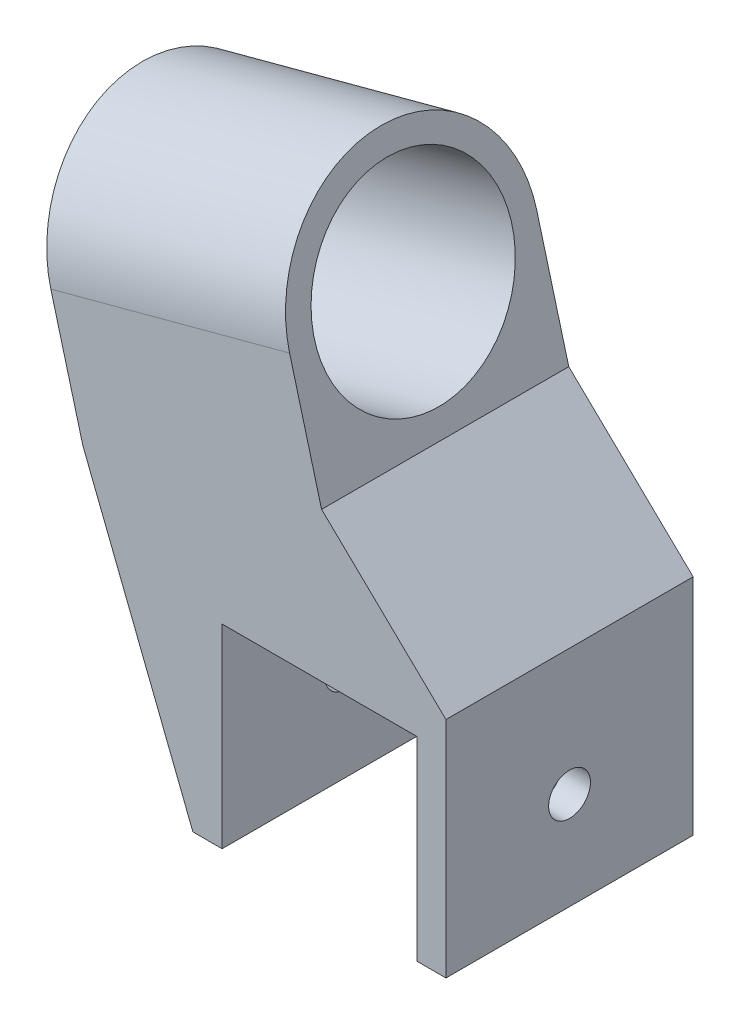
from build123d import *

# Parameters (mm, degrees)
BOSS_EXTRUDE1_DEPTH = 25.4
CUT_EXTRUDE1_DEPTH  = 56.734998059
SKETCH12_W          = 2.150000018
SKETCH12_H          = 26.00000007
SKETCH14_W          = 3.499999985
SKETCH14_H          = 17.888332324
HOLE3_D             = 20.32


with BuildPart() as part:
    # Sketch7 → Boss-Extrude1 (new body)
    with BuildSketch(Plane.XY):
        Polygon((13.000000035, 0), (0.220187374, 12.310991538), (-6.353816371, 36.845507526), (-30.888332359, 30.27150378), (-24.314328613, 5.736987792), (-13.000000035, -22.999999974), (-9.999999939, -22.999999974), (-9.999999939, -3.000000096), (9.999999939, -3.000000096), (9.999999939, -22.999999974), (13.000000035, -22.999999974), align=None)
    extrude(amount=BOSS_EXTRUDE1_DEPTH)

    # Sketch8 → Cut-Extrude1 (cut, through all)
    with BuildSketch(Plane(origin=(3.283185502, 0.879726904, 0), x_dir=(0, 0, -1), z_dir=(0.9659258262890699, 0.25881904510251463, 0))):
        with BuildLine():
            ThreePointArc((-25.4, 24.534515988), (-21.680256121, 33.514772109), (-12.7, 37.234515988))
            Line((-12.7, 37.234515988), (-25.4, 37.234515988))
            Line((-25.4, 37.234515988), (-25.4, 24.534515988))
        make_face()
        with BuildLine():
            Line((0, 24.534515988), (0, 37.234515988))
            Line((0, 37.234515988), (-12.7, 37.234515988))
            ThreePointArc((-12.7, 37.234515988), (-3.719743879, 33.514772109), (0, 24.534515988))
        make_face()
    extrude(amount=-CUT_EXTRUDE1_DEPTH, mode=Mode.SUBTRACT)

    # Sketch12 → Hole1 (revolve, cut)
    with BuildSketch(Plane(origin=(-13.000000035, -13.000000035, 12.7), x_dir=(0, 0, 1), z_dir=(0, 1, 0))):
        with Locations((1.075000009, 13.000000035)):
            Rectangle(SKETCH12_W, SKETCH12_H)
    revolve(axis=Axis((96.999999965, -13.000000035, 12.7), (-1, 0, 0)), mode=Mode.SUBTRACT)

    # Sketch14 → Hole2 (revolve, cut)
    with BuildSketch(Plane(origin=(-13.000000035, -13.000000035, 12.7), x_dir=(0, 0, -1), z_dir=(0, 1, 0))):
        with Locations((1.749999993, 8.944166162)):
            Rectangle(SKETCH14_W, SKETCH14_H)
    revolve(axis=Axis((-123.000000035, -13.000000035, 12.7), (1, 0, 0)), mode=Mode.SUBTRACT)

    # Hole3 (through all)
    with Locations(Plane(origin=(3.283185502, 0.879726904, 0), x_dir=(0, 0, -1), z_dir=(0.9659258262890699, 0.25881904510251463, 0))):
        with Locations((-12.7, 24.534515988)):
            Hole(HOLE3_D / 2)


solid = part.part
